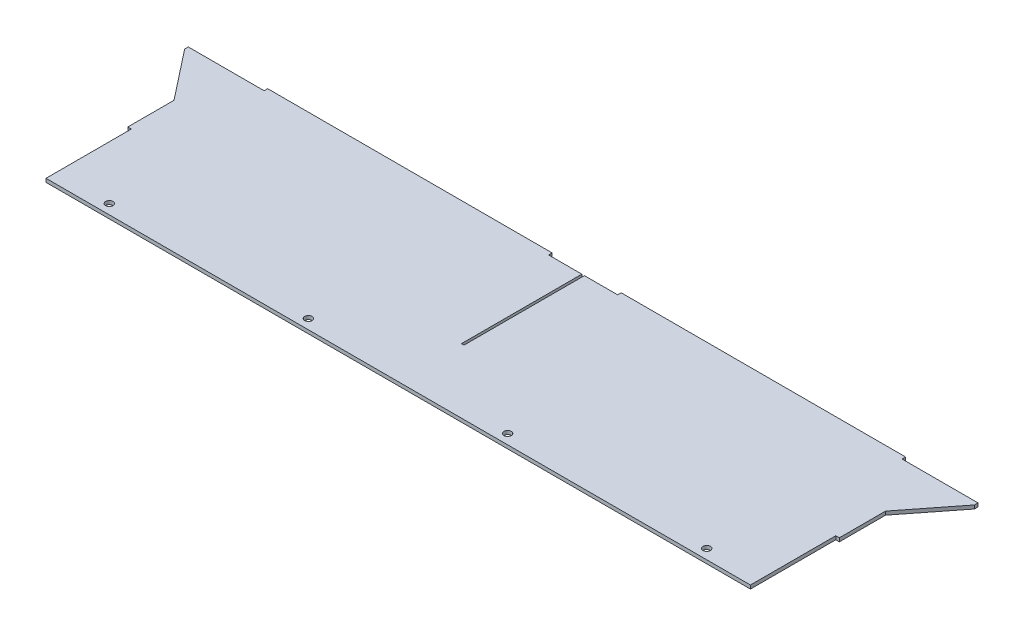
from build123d import *

# Parameters (mm, degrees)
SKETCH1_W            = 635.3556
SKETCH1_H            = 165.1
BOSS_EXTRUDE1_DEPTH  = 1.5875
SKETCH2_W            = 254
SKETCH2_H            = 3.175
BOSS_EXTRUDE2_DEPTH  = 3.175
BOSS_EXTRUDE3_DEPTH  = 3.175
SKETCH5_W            = 3.175
SKETCH5_H            = 76.2
SKETCH5_W_2          = 2.286
SKETCH5_H_2          = 107.442
CUT_EXTRUDE2_DEPTH   = 363.887848815
M6_CLEARANCE_HOLE1_D = 6.6
LPATTERN2_COUNT      = 4
LPATTERN2_PITCH      = 177.8


with BuildPart() as part:
    # Sketch1 → Boss-Extrude1 (new, symmetric)
    with BuildSketch(Plane(origin=(0, 0, 0), x_dir=(1, 0, 0), z_dir=(0, 1, 0))):
        Rectangle(SKETCH1_W, SKETCH1_H)
    extrude(amount=BOSS_EXTRUDE1_DEPTH, both=True)

    # Sketch2 → Boss-Extrude2 (add)
    with BuildSketch(Plane(origin=(0, 0, -82.55), x_dir=(-1, 0, 0), z_dir=(0, 0, -1))):
        with Locations((-157.8229, 0)):
            Rectangle(SKETCH2_W, SKETCH2_H)
        with Locations((157.8229, 0)):
            Rectangle(SKETCH2_W, SKETCH2_H)
    extrude(amount=BOSS_EXTRUDE2_DEPTH)

    # Sketch3 → Boss-Extrude3 (add)
    with BuildSketch(Plane.XZ.offset(1.5875)):
        Polygon((317.6778, -82.55), (352.6028, -82.55), (352.6028, -79.375), (317.6778, -34.925), align=None)
    boss_extrude3 = extrude(amount=-BOSS_EXTRUDE3_DEPTH)

    # Mirror1: Boss-Extrude3 across plane
    add(boss_extrude3.mirror(Plane(origin=(0, 0, 0), x_dir=(0, 0, 1), z_dir=(1, 0, 0))))

    # Sketch5 → Cut-Extrude2 (cut, through all)
    with BuildSketch(Plane.XZ.offset(1.5875)):
        with Locations((316.0903, 44.45)):
            Rectangle(SKETCH5_W, SKETCH5_H)
        with Locations((0, -28.829)):
            Rectangle(SKETCH5_W_2, SKETCH5_H_2)
        with Locations((-316.0903, 44.45)):
            Rectangle(SKETCH5_W, SKETCH5_H)
    extrude(amount=-CUT_EXTRUDE2_DEPTH, mode=Mode.SUBTRACT)

    # M6 Clearance Hole1 (through all)
    with Locations(Plane(origin=(0, 1.5875, 0), x_dir=(1, 0, 0), z_dir=(0, 1, 0))):
        with Locations((266.7, -73.8124)):
            m6_clearance_hole1 = Hole(M6_CLEARANCE_HOLE1_D / 2)

    # LPattern2: M6 Clearance Hole1 ×4
    with Locations(*[(-i * LPATTERN2_PITCH, 0, 0) for i in range(1, LPATTERN2_COUNT)]):
        add(m6_clearance_hole1, mode=Mode.SUBTRACT)


solid = part.part
